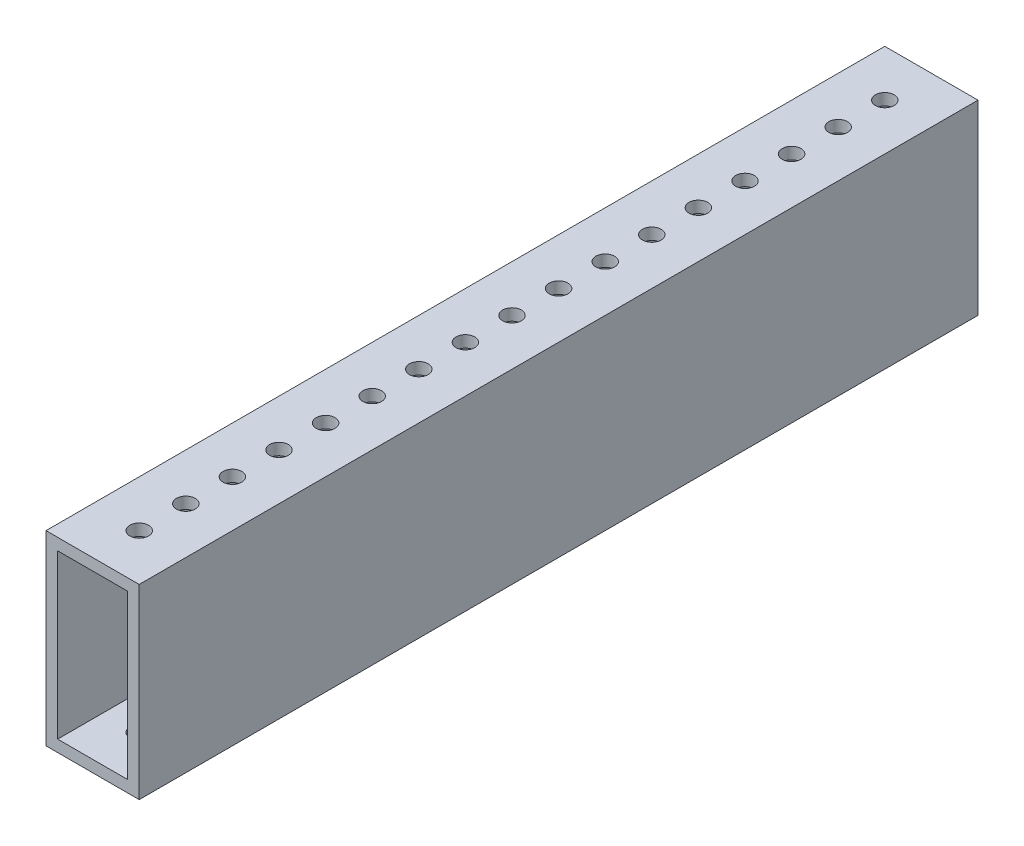
from build123d import *

# Parameters (mm, degrees)
SKETCH1_W           = 25.4
SKETCH1_H           = 50.8
SKETCH1_W_2         = 19.05
SKETCH1_H_2         = 44.45
BOSS_EXTRUDE1_DEPTH = 114.3
SKETCH2_R           = 2.5527
CUT_EXTRUDE1_DEPTH  = 126.723585695


with BuildPart() as part:
    # Sketch1 → Boss-Extrude1 (new, symmetric)
    with BuildSketch(Plane.XY):
        Rectangle(SKETCH1_W, SKETCH1_H)
        Rectangle(SKETCH1_W_2, SKETCH1_H_2, mode=Mode.SUBTRACT)
    extrude(amount=BOSS_EXTRUDE1_DEPTH, both=True)

    # Sketch2 → Cut-Extrude1 (cut, through all)
    with BuildSketch(Plane(origin=(0, 25.4, 0), x_dir=(1, 0, 0), z_dir=(0, 1, 0))):
        with Locations((0, -101.6)):
            Circle(SKETCH2_R)
        with Locations((0, -88.9)):
            Circle(SKETCH2_R)
        with Locations((0, -76.2)):
            Circle(SKETCH2_R)
        with Locations((0, -63.5)):
            Circle(SKETCH2_R)
        with Locations((0, -50.8)):
            Circle(SKETCH2_R)
        with Locations((0, -38.1)):
            Circle(SKETCH2_R)
        with Locations((0, -25.4)):
            Circle(SKETCH2_R)
        with Locations((0, -12.7)):
            Circle(SKETCH2_R)
        Circle(SKETCH2_R)
        with Locations((0, 12.7)):
            Circle(SKETCH2_R)
        with Locations((0, 25.4)):
            Circle(SKETCH2_R)
        with Locations((0, 38.1)):
            Circle(SKETCH2_R)
        with Locations((0, 50.8)):
            Circle(SKETCH2_R)
        with Locations((0, 63.5)):
            Circle(SKETCH2_R)
        with Locations((0, 76.2)):
            Circle(SKETCH2_R)
        with Locations((0, 88.9)):
            Circle(SKETCH2_R)
        with Locations((0, 101.6)):
            Circle(SKETCH2_R)
    extrude(amount=-CUT_EXTRUDE1_DEPTH, mode=Mode.SUBTRACT)


solid = part.part
